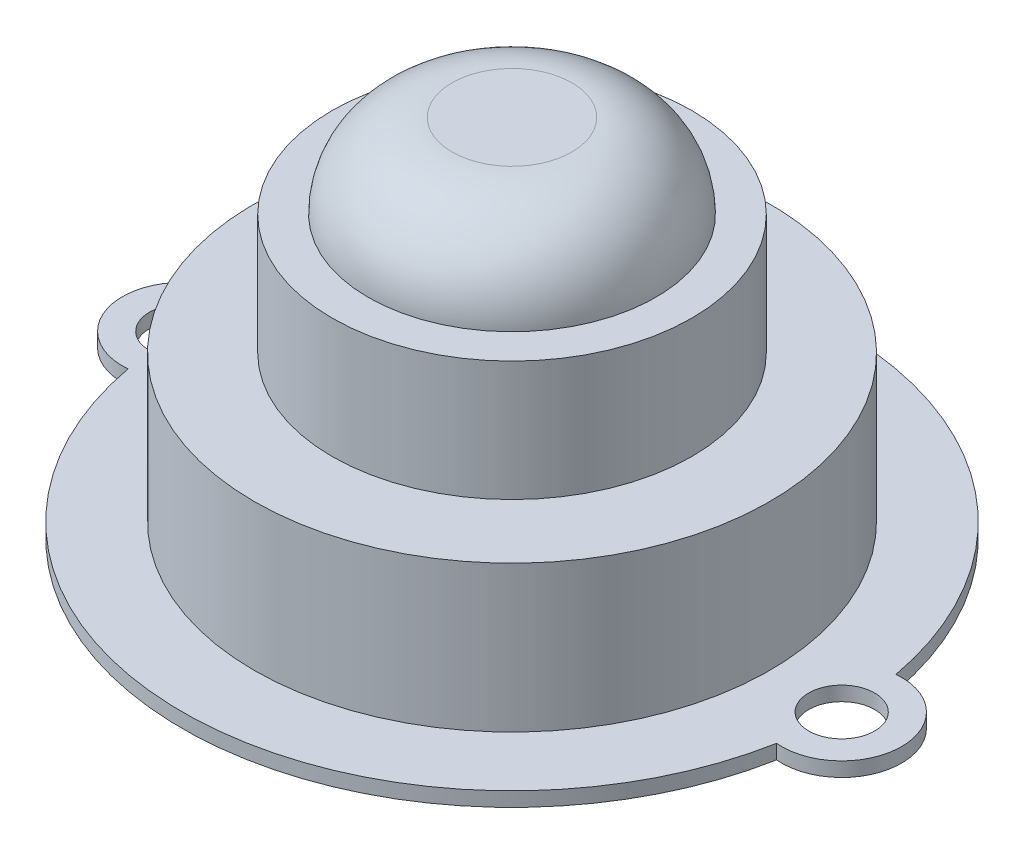
from build123d import *

# Parameters (mm, degrees)
SKETCH1_R           = 2.75
BOSS_EXTRUDE1_DEPTH = 1.2
SKETCH2_R           = 21.5
BOSS_EXTRUDE2_DEPTH = 12.2
SKETCH3_R           = 15
BOSS_EXTRUDE3_DEPTH = 10
SKETCH5_R           = 12
BOSS_EXTRUDE4_DEPTH = 7
FILLET1_R           = 7


with BuildPart() as part:
    # Sketch1 → Boss-Extrude1 (new body)
    with BuildSketch(Plane(origin=(0, 0, 0), x_dir=(1, 0, 0), z_dir=(0, 1, 0))):
        with BuildLine():
            ThreePointArc((-27.045454545, -4.979295977), (0, -27.5), (27.045454545, -4.979295977))
            ThreePointArc((27.045454545, -4.979295977), (32.5, 0), (27.045454545, 4.979295977))
            ThreePointArc((27.045454545, 4.979295977), (0, 27.5), (-27.045454545, 4.979295977))
            ThreePointArc((-27.045454545, 4.979295977), (-32.5, 0), (-27.045454545, -4.979295977))
        make_face()
        with Locations(Location((-27.5, 0, 0), (0, 0, 270))):
            Circle(SKETCH1_R, mode=Mode.SUBTRACT)
        with Locations(Location((27.5, 0, 0), (0, 0, 270))):
            Circle(SKETCH1_R, mode=Mode.SUBTRACT)
    extrude(amount=BOSS_EXTRUDE1_DEPTH)

    # Sketch2 → Boss-Extrude2 (add)
    with BuildSketch(Plane(origin=(0, 1.2, 0), x_dir=(1, 0, 0), z_dir=(0, 1, 0))):
        with Locations(Location((0, 0, 0), (0, 0, 270))):
            Circle(SKETCH2_R)
    extrude(amount=BOSS_EXTRUDE2_DEPTH)

    # Sketch3 → Boss-Extrude3 (add)
    with BuildSketch(Plane(origin=(0, 13.4, 0), x_dir=(1, 0, 0), z_dir=(0, 1, 0))):
        with Locations(Location((0, 0, 0), (0, 0, 270))):
            Circle(SKETCH3_R)
    extrude(amount=BOSS_EXTRUDE3_DEPTH)

    # Sketch5 → Boss-Extrude4 (add)
    with BuildSketch(Plane(origin=(0, 23.4, 0), x_dir=(1, 0, 0), z_dir=(0, 1, 0))):
        with Locations(Location((0, 0, 0), (0, 0, 270))):
            Circle(SKETCH5_R)
    extrude(amount=BOSS_EXTRUDE4_DEPTH)

    # Fillet1
    fillet1_edges = [part.edges().sort_by_distance(p)[0] for p in [
        (0, 30.4, -12),
    ]]
    fillet(fillet1_edges, radius=FILLET1_R - 0.0001)  # a hair under: the kernel refuses the full size


solid = part.part
